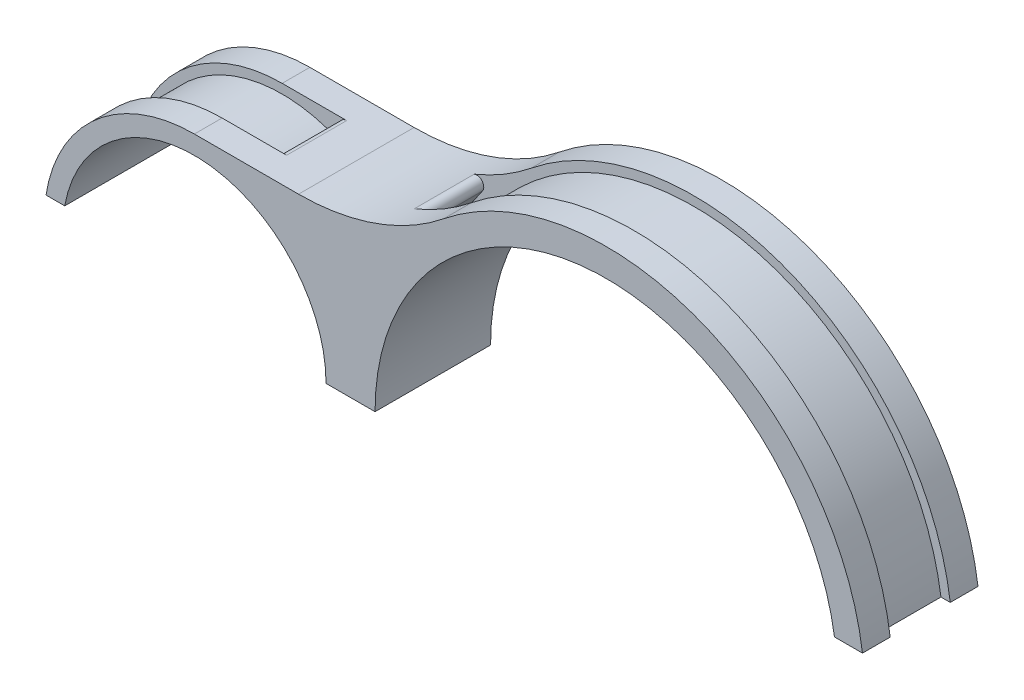
from build123d import *

# Parameters (mm, degrees)
SKETCH1_R                     = 56
SKETCH1_R_2                   = 50
MAIN_SHAPE_DEPTH              = 12.5
LIGHT_MOUNT_REACH             = 82.176
LIGHT_MOUNT_DIRECTION_2_REACH = 82.176
SKETCH3_R                     = 57
SKETCH3_R_2                   = 54
MAIN_SLOT_DEPTH               = 6.5
LIGHT_CUT_DEPTH               = 135.461332618
LIGHT_CUT_DEPTH_BACK          = 135.461332618
SKETCH8_R                     = 28.5
SKETCH9_R                     = 32.5
SKETCH9_R_2                   = 30.5
LIGHT_SLOT_DEPTH              = 6.5
LIGHT_MOUNT_FILLET_R          = 50
SKETCH17_W                    = 4.884048614
SKETCH17_H                    = 10
LIGHT_KEYWAY_DEPTH            = 137.193244948
SKETCH19_W                    = 25
SKETCH19_H                    = 15
CUT_EXTRUDE1_DEPTH            = 135.11151246
FILLET1_START                 = -6.5
FILLET1_DEPTH                 = 13
SKETCH20_W                    = 284.103750492
SKETCH20_H                    = 110.008077322
CUT_EXTRUDE2_DEPTH            = 135.11151246


with BuildPart() as part:
    # Sketch1 → main shape (new, symmetric)
    with BuildSketch(Plane.XY):
        Circle(SKETCH1_R)
        Circle(SKETCH1_R_2, mode=Mode.SUBTRACT)
    extrude(amount=MAIN_SHAPE_DEPTH, both=True)

    # light mount: up to this face of the body (flat: up to its plane)
    light_mount_end = Plane(part.part.faces().sort_by_distance((-54.41608081, 0, 12.5))[0])
    # Sketch6 → light mount (add, up to the picked face)
    with BuildSketch(Plane.XY, mode=Mode.PRIVATE) as light_mount_sk1:
        with BuildLine():
            Line((-45.604276115, 32.5), (-89.104276115, 32.5))
            ThreePointArc((-89.104276115, 32.5), (-121.604276115, 0), (-89.104276115, -32.5))
            Line((-89.104276115, -32.5), (-45.604276115, -32.5))
            ThreePointArc((-45.604276115, -32.5), (-56, 0), (-45.604276115, 32.5))
        make_face()
    light_mount_tool1 = split(extrude(light_mount_sk1.sketch, amount=LIGHT_MOUNT_REACH, mode=Mode.PRIVATE), bisect_by=light_mount_end, keep=Keep.BOTH, mode=Mode.PRIVATE)
    add(light_mount_tool1.solids().sort_by(Axis((-84.001692, 0, 0), (0, 0, 1)))[0])

    # light mount direction 2: up to this face of the body (flat: up to its plane)
    light_mount_direction_2_end = Plane(part.part.faces().sort_by_distance((-54.41608081, 0, -12.5))[0])
    # Sketch6 → light mount direction 2 (add, up to the picked face)
    with BuildSketch(Plane.XY, mode=Mode.PRIVATE) as light_mount_direction_2_sk1:
        with BuildLine():
            Line((-45.604276115, 32.5), (-89.104276115, 32.5))
            ThreePointArc((-89.104276115, 32.5), (-121.604276115, 0), (-89.104276115, -32.5))
            Line((-89.104276115, -32.5), (-45.604276115, -32.5))
            ThreePointArc((-45.604276115, -32.5), (-56, 0), (-45.604276115, 32.5))
        make_face()
    light_mount_direction_2_tool1 = split(extrude(light_mount_direction_2_sk1.sketch, amount=-LIGHT_MOUNT_DIRECTION_2_REACH, mode=Mode.PRIVATE), bisect_by=light_mount_direction_2_end, keep=Keep.BOTH, mode=Mode.PRIVATE)
    add(light_mount_direction_2_tool1.solids().sort_by(Axis((-84.001692, 0, 0), (0, 0, -1)))[0])

    # Sketch3 → main slot (cut, symmetric)
    with BuildSketch(Plane.XY):
        Circle(SKETCH3_R)
        Circle(SKETCH3_R_2, mode=Mode.SUBTRACT)
    extrude(amount=MAIN_SLOT_DEPTH, both=True, mode=Mode.SUBTRACT)

    # Sketch8 → light cut (cut, two sides: drawn at the far end of the back side and taken through both)
    with BuildSketch(Plane.XY.offset(-LIGHT_CUT_DEPTH_BACK)):
        with Locations((-89.104276115, 0)):
            Circle(SKETCH8_R)
    extrude(amount=LIGHT_CUT_DEPTH + LIGHT_CUT_DEPTH_BACK, mode=Mode.SUBTRACT)

    # Sketch9 → light slot (cut, symmetric)
    with BuildSketch(Plane.XY):
        with Locations((-89.104276115, 0)):
            Circle(SKETCH9_R)
        with Locations((-89.104276115, 0)):
            Circle(SKETCH9_R_2, mode=Mode.SUBTRACT)
    extrude(amount=LIGHT_SLOT_DEPTH, both=True, mode=Mode.SUBTRACT)

    # light mount fillet
    # the kernel refuses this fillet: 50 mm, written as the material it adds along each edge
    with BuildSketch(Plane(origin=(-45.604276115, 32.5, -12.5), x_dir=(0.6856978375591282, 0.7278863067586417, 0), z_dir=(0, 0, 1))) as light_mount_fillet_piece_1_section:
        with BuildLine():
            CenterArc((22.027511865, 49.535631995), LIGHT_MOUNT_FILLET_R, 223.290512858, 38.89464037)
            Line((-14.366803473, 15.250740117), (0, 0))
            ThreePointArc((0, 0), (7.614448546, 0.520092165), (15.228897092, 0))
        make_face()
    light_mount_fillet_piece_1 = extrude(amount=6, mode=Mode.PRIVATE)
    light_mount_fillet_piece_1 = light_mount_fillet_piece_1 & Plane(origin=(0, 0, -12.5), x_dir=(1, 0, 0), z_dir=(0, 0, 1)) * Cylinder(57, 74, mode=Mode.PRIVATE)
    add(light_mount_fillet_piece_1)
    with BuildSketch(Plane(origin=(-45.604276115, 32.5, -12.5), x_dir=(0.6856978375591282, 0.7278863067586417, 0), z_dir=(0, 0, 1))) as light_mount_fillet_piece_2_section:
        with BuildLine():
            CenterArc((22.027511865, 49.535631995), LIGHT_MOUNT_FILLET_R, 223.290512858, 38.89464037)
            Line((-14.366803473, 15.250740117), (0, 0))
            ThreePointArc((0, 0), (7.614448546, 0.520092165), (15.228897092, 0))
        make_face()
    light_mount_fillet_piece_2 = extrude(amount=6, mode=Mode.PRIVATE)
    light_mount_fillet_piece_2 = light_mount_fillet_piece_2 - Plane(origin=(0, 0, -12.5), x_dir=(1, 0, 0), z_dir=(0, 0, 1)) * Cylinder(57, 74, mode=Mode.PRIVATE)
    add(light_mount_fillet_piece_2)
    with BuildSketch(Plane(origin=(-45.604276115, 32.5, -12.5), x_dir=(0.6856978375591282, 0.7278863067586417, 0), z_dir=(0, 0, 1))) as light_mount_fillet_piece_3_section:
        with BuildLine():
            CenterArc((22.027511865, 49.535631995), LIGHT_MOUNT_FILLET_R, 223.290512858, 38.89464037)
            Line((-14.366803473, 15.250740117), (0, 0))
            ThreePointArc((0, 0), (7.614448546, 0.520092165), (15.228897092, 0))
        make_face()
    light_mount_fillet_piece_3 = extrude(amount=58.380227433, mode=Mode.PRIVATE)
    light_mount_fillet_piece_3 = split(light_mount_fillet_piece_3, bisect_by=Plane(origin=(-45.604276115, 32.5, -6.5), z_dir=(0, 0, 1)), keep=Keep.TOP, mode=Mode.PRIVATE)
    light_mount_fillet_piece_3 = split(light_mount_fillet_piece_3, bisect_by=Plane(origin=(-45.604276115, 32.5, 6.5), z_dir=(0, 0, -1)), keep=Keep.TOP, mode=Mode.PRIVATE)
    light_mount_fillet_piece_3 = light_mount_fillet_piece_3 - Plane(origin=(0, 0, -12.5), x_dir=(1, 0, 0), z_dir=(0, 0, 1)) * Cylinder(57, 178, mode=Mode.PRIVATE)
    add(light_mount_fillet_piece_3)
    with BuildSketch(Plane(origin=(-45.604276115, 32.5, -12.5), x_dir=(0.6856978375591282, 0.7278863067586417, 0), z_dir=(0, 0, 1))) as light_mount_fillet_piece_4_section:
        with BuildLine():
            CenterArc((22.027511865, 49.535631995), LIGHT_MOUNT_FILLET_R, 223.290512858, 38.89464037)
            Line((-14.366803473, 15.250740117), (0, 0))
            ThreePointArc((0, 0), (7.614448546, 0.520092165), (15.228897092, 0))
        make_face()
    light_mount_fillet_piece_4 = extrude(amount=58.380227433, mode=Mode.PRIVATE)
    light_mount_fillet_piece_4 = split(light_mount_fillet_piece_4, bisect_by=Plane(origin=(-45.604276115, 32.5, 12.5), z_dir=(0, 0, -1)), keep=Keep.TOP, mode=Mode.PRIVATE)
    light_mount_fillet_piece_4 = split(light_mount_fillet_piece_4, bisect_by=Plane(origin=(-45.604276115, 32.5, 6.5), z_dir=(0, 0, 1)), keep=Keep.TOP, mode=Mode.PRIVATE)
    light_mount_fillet_piece_4 = light_mount_fillet_piece_4 & Plane(origin=(0, 0, -12.5), x_dir=(1, 0, 0), z_dir=(0, 0, 1)) * Cylinder(57, 178, mode=Mode.PRIVATE)
    add(light_mount_fillet_piece_4)
    with BuildSketch(Plane(origin=(-45.604276115, 32.5, -12.5), x_dir=(0.6856978375591282, 0.7278863067586417, 0), z_dir=(0, 0, 1))) as light_mount_fillet_piece_5_section:
        with BuildLine():
            CenterArc((22.027511865, 49.535631995), LIGHT_MOUNT_FILLET_R, 223.290512858, 38.89464037)
            Line((-14.366803473, 15.250740117), (0, 0))
            ThreePointArc((0, 0), (7.614448546, 0.520092165), (15.228897092, 0))
        make_face()
    light_mount_fillet_piece_5 = extrude(amount=58.380227433, mode=Mode.PRIVATE)
    light_mount_fillet_piece_5 = split(light_mount_fillet_piece_5, bisect_by=Plane(origin=(-45.604276115, 32.5, 12.5), z_dir=(0, 0, -1)), keep=Keep.TOP, mode=Mode.PRIVATE)
    light_mount_fillet_piece_5 = split(light_mount_fillet_piece_5, bisect_by=Plane(origin=(-45.604276115, 32.5, 6.5), z_dir=(0, 0, 1)), keep=Keep.TOP, mode=Mode.PRIVATE)
    light_mount_fillet_piece_5 = light_mount_fillet_piece_5 - Plane(origin=(0, 0, -12.5), x_dir=(1, 0, 0), z_dir=(0, 0, 1)) * Cylinder(57, 178, mode=Mode.PRIVATE)
    add(light_mount_fillet_piece_5)
    with BuildSketch(Plane(origin=(-45.604276115, 32.5, -45.880227433), x_dir=(-1, 0, 0), z_dir=(0, 0, 1))) as light_mount_fillet_piece_6_section:
        with BuildLine():
            CenterArc((20.952090973, -50), LIGHT_MOUNT_FILLET_R, 90, 38.89464037)
            ThreePointArc((-10.442421804, -11.08490566), (-4.842642937, -5.899078903), (0, 0))
            Line((0, 0), (20.952090973, 0))
        make_face()
    light_mount_fillet_piece_6 = extrude(amount=58.380227433, mode=Mode.PRIVATE)
    light_mount_fillet_piece_6 = split(light_mount_fillet_piece_6, bisect_by=Plane(origin=(-45.604276115, 32.5, -6.5), z_dir=(0, 0, -1)), keep=Keep.TOP, mode=Mode.PRIVATE)
    light_mount_fillet_piece_6 = split(light_mount_fillet_piece_6, bisect_by=Plane(origin=(-45.604276115, 32.5, -12.5), z_dir=(0, 0, 1)), keep=Keep.TOP, mode=Mode.PRIVATE)
    light_mount_fillet_piece_6 = light_mount_fillet_piece_6 - Plane(origin=(0, 0, -45.880227433), x_dir=(1, 0, 0), z_dir=(0, 0, 1)) * Cylinder(57, 201, mode=Mode.PRIVATE)
    add(light_mount_fillet_piece_6)
    with BuildSketch(Plane(origin=(-45.604276115, 32.5, -45.880227433), x_dir=(-1, 0, 0), z_dir=(0, 0, 1))) as light_mount_fillet_piece_7_section:
        with BuildLine():
            CenterArc((20.952090973, -50), LIGHT_MOUNT_FILLET_R, 90, 38.89464037)
            ThreePointArc((-10.442421804, -11.08490566), (-4.842642937, -5.899078903), (0, 0))
            Line((0, 0), (20.952090973, 0))
        make_face()
    light_mount_fillet_piece_7 = extrude(amount=58.380227433, mode=Mode.PRIVATE)
    light_mount_fillet_piece_7 = split(light_mount_fillet_piece_7, bisect_by=Plane(origin=(-45.604276115, 32.5, -6.5), z_dir=(0, 0, -1)), keep=Keep.TOP, mode=Mode.PRIVATE)
    light_mount_fillet_piece_7 = split(light_mount_fillet_piece_7, bisect_by=Plane(origin=(-45.604276115, 32.5, -12.5), z_dir=(0, 0, 1)), keep=Keep.TOP, mode=Mode.PRIVATE)
    light_mount_fillet_piece_7 = light_mount_fillet_piece_7 & Plane(origin=(0, 0, -45.880227433), x_dir=(1, 0, 0), z_dir=(0, 0, 1)) * Cylinder(57, 201, mode=Mode.PRIVATE)
    add(light_mount_fillet_piece_7)
    with BuildSketch(Plane(origin=(-45.604276115, 32.5, -45.880227433), x_dir=(-1, 0, 0), z_dir=(0, 0, 1))) as light_mount_fillet_piece_8_section:
        with BuildLine():
            CenterArc((20.952090973, -50), LIGHT_MOUNT_FILLET_R, 90, 38.89464037)
            ThreePointArc((-10.442421804, -11.08490566), (-4.842642937, -5.899078903), (0, 0))
            Line((0, 0), (20.952090973, 0))
        make_face()
    light_mount_fillet_piece_8 = extrude(amount=58.380227433, mode=Mode.PRIVATE)
    light_mount_fillet_piece_8 = split(light_mount_fillet_piece_8, bisect_by=Plane(origin=(-45.604276115, 32.5, -6.5), z_dir=(0, 0, 1)), keep=Keep.TOP, mode=Mode.PRIVATE)
    light_mount_fillet_piece_8 = split(light_mount_fillet_piece_8, bisect_by=Plane(origin=(-45.604276115, 32.5, 6.5), z_dir=(0, 0, -1)), keep=Keep.TOP, mode=Mode.PRIVATE)
    light_mount_fillet_piece_8 = light_mount_fillet_piece_8 - Plane(origin=(0, 0, -45.880227433), x_dir=(1, 0, 0), z_dir=(0, 0, 1)) * Cylinder(57, 201, mode=Mode.PRIVATE)
    add(light_mount_fillet_piece_8)
    with BuildSketch(Plane(origin=(-45.604276115, 32.5, 6.5), x_dir=(-1, 0, 0), z_dir=(0, 0, 1))) as light_mount_fillet_piece_9_section:
        with BuildLine():
            CenterArc((20.952090973, -50), LIGHT_MOUNT_FILLET_R, 90, 38.89464037)
            ThreePointArc((-10.442421804, -11.08490566), (-4.842642937, -5.899078903), (0, 0))
            Line((0, 0), (20.952090973, 0))
        make_face()
    light_mount_fillet_piece_9 = extrude(amount=6, mode=Mode.PRIVATE)
    light_mount_fillet_piece_9 = light_mount_fillet_piece_9 - Plane(origin=(0, 0, 6.5), x_dir=(1, 0, 0), z_dir=(0, 0, 1)) * Cylinder(57, 96, mode=Mode.PRIVATE)
    add(light_mount_fillet_piece_9)
    with BuildSketch(Plane(origin=(-45.604276115, 32.5, 6.5), x_dir=(-1, 0, 0), z_dir=(0, 0, 1))) as light_mount_fillet_piece_10_section:
        with BuildLine():
            CenterArc((20.952090973, -50), LIGHT_MOUNT_FILLET_R, 90, 38.89464037)
            ThreePointArc((-10.442421804, -11.08490566), (-4.842642937, -5.899078903), (0, 0))
            Line((0, 0), (20.952090973, 0))
        make_face()
    light_mount_fillet_piece_10 = extrude(amount=6, mode=Mode.PRIVATE)
    light_mount_fillet_piece_10 = light_mount_fillet_piece_10 & Plane(origin=(0, 0, 6.5), x_dir=(1, 0, 0), z_dir=(0, 0, 1)) * Cylinder(57, 96, mode=Mode.PRIVATE)
    add(light_mount_fillet_piece_10)
    with BuildSketch(Plane(origin=(-45.604276115, -32.5, 12.5), x_dir=(-1, 0, 0), z_dir=(0, 0, -1))) as light_mount_fillet_piece_11_section:
        with BuildLine():
            CenterArc((20.952090973, -50), LIGHT_MOUNT_FILLET_R, 90, 38.89464037)
            ThreePointArc((-10.442421804, -11.08490566), (-4.842642937, -5.899078903), (0, 0))
            Line((0, 0), (20.952090973, 0))
        make_face()
    light_mount_fillet_piece_11 = extrude(amount=6, mode=Mode.PRIVATE)
    light_mount_fillet_piece_11 = light_mount_fillet_piece_11 - Plane(origin=(0, 0, 12.5), x_dir=(1, 0, 0), z_dir=(0, 0, 1)) * Cylinder(57, 96, mode=Mode.PRIVATE)
    add(light_mount_fillet_piece_11)
    with BuildSketch(Plane(origin=(-45.604276115, -32.5, 12.5), x_dir=(-1, 0, 0), z_dir=(0, 0, -1))) as light_mount_fillet_piece_12_section:
        with BuildLine():
            CenterArc((20.952090973, -50), LIGHT_MOUNT_FILLET_R, 90, 38.89464037)
            ThreePointArc((-10.442421804, -11.08490566), (-4.842642937, -5.899078903), (0, 0))
            Line((0, 0), (20.952090973, 0))
        make_face()
    light_mount_fillet_piece_12 = extrude(amount=6, mode=Mode.PRIVATE)
    light_mount_fillet_piece_12 = light_mount_fillet_piece_12 & Plane(origin=(0, 0, 12.5), x_dir=(1, 0, 0), z_dir=(0, 0, 1)) * Cylinder(57, 96, mode=Mode.PRIVATE)
    add(light_mount_fillet_piece_12)
    with BuildSketch(Plane(origin=(-45.604276115, -32.5, 12.5), x_dir=(-1, 0, 0), z_dir=(0, 0, -1))) as light_mount_fillet_piece_13_section:
        with BuildLine():
            CenterArc((20.952090973, -50), LIGHT_MOUNT_FILLET_R, 90, 38.89464037)
            ThreePointArc((-10.442421804, -11.08490566), (-4.842642937, -5.899078903), (0, 0))
            Line((0, 0), (20.952090973, 0))
        make_face()
    light_mount_fillet_piece_13 = extrude(amount=58.380227433, mode=Mode.PRIVATE)
    light_mount_fillet_piece_13 = split(light_mount_fillet_piece_13, bisect_by=Plane(origin=(-45.604276115, -32.5, -6.5), z_dir=(0, 0, 1)), keep=Keep.TOP, mode=Mode.PRIVATE)
    light_mount_fillet_piece_13 = split(light_mount_fillet_piece_13, bisect_by=Plane(origin=(-45.604276115, -32.5, 6.5), z_dir=(0, 0, -1)), keep=Keep.TOP, mode=Mode.PRIVATE)
    light_mount_fillet_piece_13 = light_mount_fillet_piece_13 - Plane(origin=(0, 0, 12.5), x_dir=(1, 0, 0), z_dir=(0, 0, 1)) * Cylinder(57, 201, mode=Mode.PRIVATE)
    add(light_mount_fillet_piece_13)
    with BuildSketch(Plane(origin=(-45.604276115, -32.5, 12.5), x_dir=(-1, 0, 0), z_dir=(0, 0, -1))) as light_mount_fillet_piece_14_section:
        with BuildLine():
            CenterArc((20.952090973, -50), LIGHT_MOUNT_FILLET_R, 90, 38.89464037)
            ThreePointArc((-10.442421804, -11.08490566), (-4.842642937, -5.899078903), (0, 0))
            Line((0, 0), (20.952090973, 0))
        make_face()
    light_mount_fillet_piece_14 = extrude(amount=58.380227433, mode=Mode.PRIVATE)
    light_mount_fillet_piece_14 = split(light_mount_fillet_piece_14, bisect_by=Plane(origin=(-45.604276115, -32.5, -6.5), z_dir=(0, 0, -1)), keep=Keep.TOP, mode=Mode.PRIVATE)
    light_mount_fillet_piece_14 = split(light_mount_fillet_piece_14, bisect_by=Plane(origin=(-45.604276115, -32.5, -12.5), z_dir=(0, 0, 1)), keep=Keep.TOP, mode=Mode.PRIVATE)
    light_mount_fillet_piece_14 = light_mount_fillet_piece_14 - Plane(origin=(0, 0, 12.5), x_dir=(1, 0, 0), z_dir=(0, 0, 1)) * Cylinder(57, 201, mode=Mode.PRIVATE)
    add(light_mount_fillet_piece_14)
    with BuildSketch(Plane(origin=(-45.604276115, -32.5, 12.5), x_dir=(-1, 0, 0), z_dir=(0, 0, -1))) as light_mount_fillet_piece_15_section:
        with BuildLine():
            CenterArc((20.952090973, -50), LIGHT_MOUNT_FILLET_R, 90, 38.89464037)
            ThreePointArc((-10.442421804, -11.08490566), (-4.842642937, -5.899078903), (0, 0))
            Line((0, 0), (20.952090973, 0))
        make_face()
    light_mount_fillet_piece_15 = extrude(amount=58.380227433, mode=Mode.PRIVATE)
    light_mount_fillet_piece_15 = split(light_mount_fillet_piece_15, bisect_by=Plane(origin=(-45.604276115, -32.5, -6.5), z_dir=(0, 0, -1)), keep=Keep.TOP, mode=Mode.PRIVATE)
    light_mount_fillet_piece_15 = split(light_mount_fillet_piece_15, bisect_by=Plane(origin=(-45.604276115, -32.5, -12.5), z_dir=(0, 0, 1)), keep=Keep.TOP, mode=Mode.PRIVATE)
    light_mount_fillet_piece_15 = light_mount_fillet_piece_15 & Plane(origin=(0, 0, 12.5), x_dir=(1, 0, 0), z_dir=(0, 0, 1)) * Cylinder(57, 201, mode=Mode.PRIVATE)
    add(light_mount_fillet_piece_15)
    with BuildSketch(Plane(origin=(-45.604276115, -32.5, 45.880227433), x_dir=(0.6856978375591277, -0.7278863067586421, 0), z_dir=(0, 0, -1))) as light_mount_fillet_piece_16_section:
        with BuildLine():
            CenterArc((22.027511865, 49.535631995), LIGHT_MOUNT_FILLET_R, 223.290512858, 38.89464037)
            Line((-14.366803473, 15.250740117), (0, 0))
            ThreePointArc((0, 0), (7.614448546, 0.520092165), (15.228897092, 0))
        make_face()
    light_mount_fillet_piece_16 = extrude(amount=58.380227433, mode=Mode.PRIVATE)
    light_mount_fillet_piece_16 = split(light_mount_fillet_piece_16, bisect_by=Plane(origin=(-45.604276115, -32.5, 6.5), z_dir=(0, 0, 1)), keep=Keep.TOP, mode=Mode.PRIVATE)
    light_mount_fillet_piece_16 = light_mount_fillet_piece_16 & Plane(origin=(0, 0, 45.880227433), x_dir=(1, 0, 0), z_dir=(0, 0, 1)) * Cylinder(57, 178, mode=Mode.PRIVATE)
    light_mount_fillet_piece_16 = split(light_mount_fillet_piece_16, bisect_by=Plane(origin=(-45.604276115, -32.5, 12.5), z_dir=(0, 0, -1)), keep=Keep.TOP, mode=Mode.PRIVATE)
    add(light_mount_fillet_piece_16)
    with BuildSketch(Plane(origin=(-45.604276115, -32.5, 45.880227433), x_dir=(0.6856978375591277, -0.7278863067586421, 0), z_dir=(0, 0, -1))) as light_mount_fillet_piece_17_section:
        with BuildLine():
            CenterArc((22.027511865, 49.535631995), LIGHT_MOUNT_FILLET_R, 223.290512858, 38.89464037)
            Line((-14.366803473, 15.250740117), (0, 0))
            ThreePointArc((0, 0), (7.614448546, 0.520092165), (15.228897092, 0))
        make_face()
    light_mount_fillet_piece_17 = extrude(amount=58.380227433, mode=Mode.PRIVATE)
    light_mount_fillet_piece_17 = split(light_mount_fillet_piece_17, bisect_by=Plane(origin=(-45.604276115, -32.5, 6.5), z_dir=(0, 0, 1)), keep=Keep.TOP, mode=Mode.PRIVATE)
    light_mount_fillet_piece_17 = light_mount_fillet_piece_17 - Plane(origin=(0, 0, 45.880227433), x_dir=(1, 0, 0), z_dir=(0, 0, 1)) * Cylinder(57, 178, mode=Mode.PRIVATE)
    light_mount_fillet_piece_17 = split(light_mount_fillet_piece_17, bisect_by=Plane(origin=(-45.604276115, -32.5, 12.5), z_dir=(0, 0, -1)), keep=Keep.TOP, mode=Mode.PRIVATE)
    add(light_mount_fillet_piece_17)
    with BuildSketch(Plane(origin=(-45.604276115, -32.5, 45.880227433), x_dir=(0.6856978375591277, -0.7278863067586421, 0), z_dir=(0, 0, -1))) as light_mount_fillet_piece_18_section:
        with BuildLine():
            CenterArc((22.027511865, 49.535631995), LIGHT_MOUNT_FILLET_R, 223.290512858, 38.89464037)
            Line((-14.366803473, 15.250740117), (0, 0))
            ThreePointArc((0, 0), (7.614448546, 0.520092165), (15.228897092, 0))
        make_face()
    light_mount_fillet_piece_18 = extrude(amount=58.380227433, mode=Mode.PRIVATE)
    light_mount_fillet_piece_18 = split(light_mount_fillet_piece_18, bisect_by=Plane(origin=(-45.604276115, -32.5, -6.5), z_dir=(0, 0, 1)), keep=Keep.TOP, mode=Mode.PRIVATE)
    light_mount_fillet_piece_18 = split(light_mount_fillet_piece_18, bisect_by=Plane(origin=(-45.604276115, -32.5, 6.5), z_dir=(0, 0, -1)), keep=Keep.TOP, mode=Mode.PRIVATE)
    light_mount_fillet_piece_18 = light_mount_fillet_piece_18 - Plane(origin=(0, 0, 45.880227433), x_dir=(1, 0, 0), z_dir=(0, 0, 1)) * Cylinder(57, 178, mode=Mode.PRIVATE)
    add(light_mount_fillet_piece_18)
    with BuildSketch(Plane(origin=(-45.604276115, -32.5, -6.5), x_dir=(0.6856978375591277, -0.7278863067586421, 0), z_dir=(0, 0, -1))) as light_mount_fillet_piece_19_section:
        with BuildLine():
            CenterArc((22.027511865, 49.535631995), LIGHT_MOUNT_FILLET_R, 223.290512858, 38.89464037)
            Line((-14.366803473, 15.250740117), (0, 0))
            ThreePointArc((0, 0), (7.614448546, 0.520092165), (15.228897092, 0))
        make_face()
    light_mount_fillet_piece_19 = extrude(amount=6, mode=Mode.PRIVATE)
    light_mount_fillet_piece_19 = light_mount_fillet_piece_19 & Plane(origin=(0, 0, -6.5), x_dir=(1, 0, 0), z_dir=(0, 0, 1)) * Cylinder(57, 74, mode=Mode.PRIVATE)
    add(light_mount_fillet_piece_19)
    with BuildSketch(Plane(origin=(-45.604276115, -32.5, -6.5), x_dir=(0.6856978375591277, -0.7278863067586421, 0), z_dir=(0, 0, -1))) as light_mount_fillet_piece_20_section:
        with BuildLine():
            CenterArc((22.027511865, 49.535631995), LIGHT_MOUNT_FILLET_R, 223.290512858, 38.89464037)
            Line((-14.366803473, 15.250740117), (0, 0))
            ThreePointArc((0, 0), (7.614448546, 0.520092165), (15.228897092, 0))
        make_face()
    light_mount_fillet_piece_20 = extrude(amount=6, mode=Mode.PRIVATE)
    light_mount_fillet_piece_20 = light_mount_fillet_piece_20 - Plane(origin=(0, 0, -6.5), x_dir=(1, 0, 0), z_dir=(0, 0, 1)) * Cylinder(57, 74, mode=Mode.PRIVATE)
    add(light_mount_fillet_piece_20)

    # Sketch17 → light keyway (cut, through all)
    with BuildSketch(Plane(origin=(0, 0, -12.5), x_dir=(-1, 0, 0), z_dir=(0, 0, -1))):
        with Locations((119.604276115, 0)):
            Rectangle(SKETCH17_W, SKETCH17_H)
    extrude(amount=-LIGHT_KEYWAY_DEPTH, mode=Mode.SUBTRACT)

    # Sketch19 → Cut-Extrude1 (cut, through all)
    with BuildSketch(Plane(origin=(0, 0, 0), x_dir=(0, 0, -1), z_dir=(1, 0, 0))):
        Rectangle(SKETCH19_W, SKETCH19_H)
    extrude(amount=CUT_EXTRUDE1_DEPTH, mode=Mode.SUBTRACT)

    # Fillet1: read off the stored shape, not the designer's step
    # Fillet1 outline → Fillet1 (cut)
    with BuildSketch(Plane.XY.offset(FILLET1_START)):
        with BuildLine():
            ThreePointArc((-41.163605135, -39.427878618), (-43.551229208, -36.773501798), (-45.767993257, -33.974855309))
            ThreePointArc((-45.767993257, -33.974855309), (-45.788490057, -35.789975391), (-47.542820528, -36.256243154))
            ThreePointArc((-47.542820528, -36.256243154), (-44.296652875, -37.728299974), (-41.163605135, -39.427878618))
        make_face()
        with BuildLine():
            ThreePointArc((-75.140036072, -32.5), (-76.606574613, -31.315063018), (-75.756105485, -29.632352941))
            ThreePointArc((-75.756105485, -29.632352941), (-82.277910705, -31.775001735), (-89.104276115, -32.5))
            Line((-89.104276115, -32.5), (-75.140036072, -32.5))
        make_face()
        with BuildLine():
            ThreePointArc((-47.542820528, 36.256243154), (-45.788490057, 35.789975391), (-45.767993256, 33.974855309))
            ThreePointArc((-45.767993256, 33.974855309), (-43.551229208, 36.773501798), (-41.163605135, 39.427878618))
            ThreePointArc((-41.163605135, 39.427878618), (-44.296652875, 37.728299974), (-47.542820528, 36.256243154))
        make_face()
        with BuildLine():
            ThreePointArc((-89.104276115, 32.5), (-82.277910705, 31.775001735), (-75.756105485, 29.632352941))
            ThreePointArc((-75.756105485, 29.632352941), (-76.606574613, 31.315063018), (-75.140036072, 32.5))
            Line((-75.140036072, 32.5), (-89.104276115, 32.5))
        make_face()
    extrude(amount=FILLET1_DEPTH, mode=Mode.SUBTRACT)

    # Sketch20 → Cut-Extrude2 (cut, through all)
    with BuildSketch(Plane(origin=(0, 0, 0), x_dir=(1, 0, 0), z_dir=(0, 1, 0))):
        Rectangle(SKETCH20_W, SKETCH20_H)
    extrude(amount=-CUT_EXTRUDE2_DEPTH, mode=Mode.SUBTRACT)


solid = part.part
